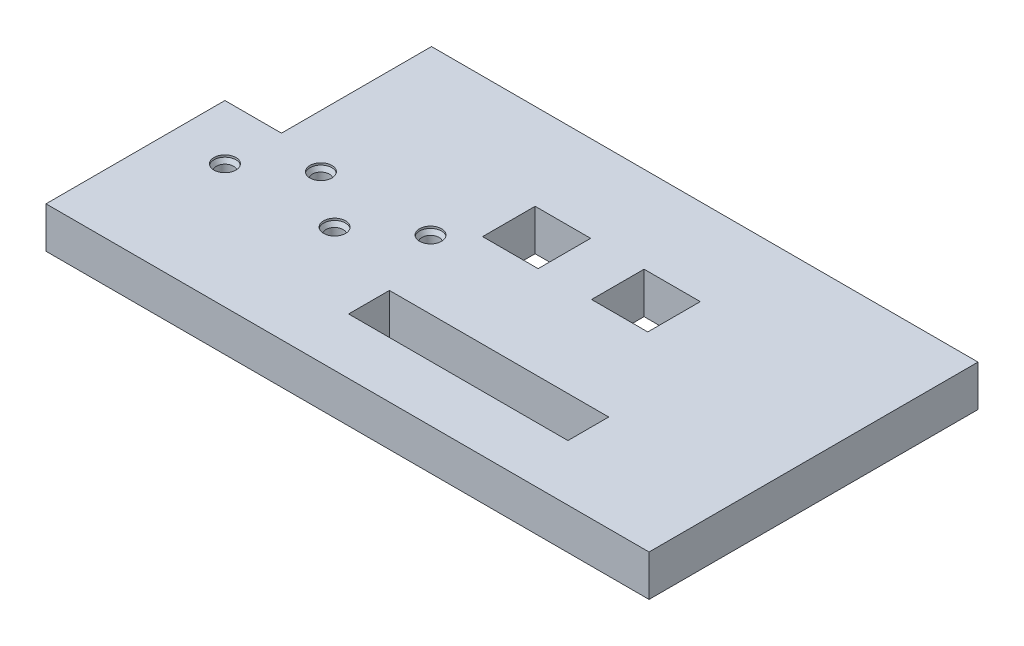
from build123d import *

# Parameters (mm, degrees)
SKETCH1_W                  = 220
SKETCH1_H                  = 120
BOSS_EXTRUDE1_DEPTH        = 15
CUT_EXTRUDE1_REACH         = 128.194
SKETCH2_W                  = 20.632503002
SKETCH2_H                  = 54.730004003
CUT_EXTRUDE2_REACH         = 128.194
SKETCH3_W                  = 20.25
SKETCH3_H                  = 19.16
SKETCH3_W_2                = 20.5
CUT_EXTRUDE3_REACH         = 128.194
SKETCH4_W                  = 80
SKETCH4_H                  = 14.88
F_6_2_6_2_DIAMETER_HOLE1_D = 6.2
SKETCH8_R                  = 4
CUT_EXTRUDE4_DEPTH         = 0.5
CHAMFER1_SIZE              = 1.8
CHAMFER1_SIZE_2            = 1.039230485


with BuildPart() as part:
    # Sketch1 → Boss-Extrude1 (new body)
    with BuildSketch(Plane(origin=(0, 0, 0), x_dir=(1, 0, 0), z_dir=(0, 1, 0))):
        Rectangle(SKETCH1_W, SKETCH1_H)
    extrude(amount=-BOSS_EXTRUDE1_DEPTH)

    # Sketch2 → Cut-Extrude1 (cut, up to next)
    with BuildSketch(Plane(origin=(0, 0, 0), x_dir=(1, 0, 0), z_dir=(0, 1, 0)), mode=Mode.PRIVATE) as cut_extrude1_sk1:
        with Locations((-99.683748499, 32.634997999)):
            Rectangle(SKETCH2_W, SKETCH2_H)
    cut_extrude1_tool1 = extrude(cut_extrude1_sk1.sketch, amount=-CUT_EXTRUDE1_REACH, mode=Mode.PRIVATE) & part.part
    add(cut_extrude1_tool1.solids().sort_by_distance((-99.683748, 0, -32.634998))[0], mode=Mode.SUBTRACT)

    # Sketch3 → Cut-Extrude2 (cut, up to next)
    with BuildSketch(Plane(origin=(0, 0, 0), x_dir=(1, 0, 0), z_dir=(0, 1, 0)), mode=Mode.PRIVATE) as cut_extrude2_sk1:
        with Locations((-9.875, 18.86)):
            Rectangle(SKETCH3_W, SKETCH3_H)
    cut_extrude2_tool1 = extrude(cut_extrude2_sk1.sketch, amount=-CUT_EXTRUDE2_REACH, mode=Mode.PRIVATE) & part.part
    # Sketch3 → Cut-Extrude2 (cut, up to next)
    with BuildSketch(Plane(origin=(0, 0, 0), x_dir=(1, 0, 0), z_dir=(0, 1, 0)), mode=Mode.PRIVATE) as cut_extrude2_sk2:
        with Locations((30, 18.86)):
            Rectangle(SKETCH3_W_2, SKETCH3_H)
    cut_extrude2_tool2 = extrude(cut_extrude2_sk2.sketch, amount=-CUT_EXTRUDE2_REACH, mode=Mode.PRIVATE) & part.part
    add(cut_extrude2_tool1.solids().sort_by_distance((-9.875, 0, -18.86))[0], mode=Mode.SUBTRACT)
    add(cut_extrude2_tool2.solids().sort_by_distance((30, 0, -18.86))[0], mode=Mode.SUBTRACT)

    # Sketch4 → Cut-Extrude3 (cut, up to next)
    with BuildSketch(Plane(origin=(0, 0, 0), x_dir=(1, 0, 0), z_dir=(0, 1, 0)), mode=Mode.PRIVATE) as cut_extrude3_sk1:
        with Locations((20, -32.16)):
            Rectangle(SKETCH4_W, SKETCH4_H)
    cut_extrude3_tool1 = extrude(cut_extrude3_sk1.sketch, amount=-CUT_EXTRUDE3_REACH, mode=Mode.PRIVATE) & part.part
    add(cut_extrude3_tool1.solids().sort_by_distance((20, 0, 32.16))[0], mode=Mode.SUBTRACT)

    # Ø6.2 (6.2) Diameter Hole1 (through all)
    with Locations(Plane(origin=(0, 0, 0), x_dir=(1, 0, 0), z_dir=(0, 1, 0))):
        with Locations((-30, 0.28), (-50, -14.72), (-70, 0.28), (-90, -14.72)):
            Hole(F_6_2_6_2_DIAMETER_HOLE1_D / 2)

    # Sketch8 → Cut-Extrude4 (cut)
    with BuildSketch(Plane(origin=(0, 0, 0), x_dir=(1, 0, 0), z_dir=(0, 1, 0))):
        with Locations(Location((-90, -14.72, 0), (0, 0, 270))):
            Circle(SKETCH8_R)
        with Locations(Location((-70, 0.28, 0), (0, 0, 270))):
            Circle(SKETCH8_R)
        with Locations(Location((-50, -14.72, 0), (0, 0, 270))):
            Circle(SKETCH8_R)
        with Locations(Location((-30, 0.28, 0), (0, 0, 270))):
            Circle(SKETCH8_R)
    extrude(amount=-CUT_EXTRUDE4_DEPTH, mode=Mode.SUBTRACT)

    # Chamfer1
    # the kernel refuses this chamfer: 1.8, 1.039230485 mm, written as the material it takes off along each edge
    with BuildSketch(Plane(origin=(-90, -0.5, 14.72), x_dir=(-1, 0, 0), z_dir=(0, 0, 1))) as chamfer1_piece_1_section:
        Polygon((3.1, CHAMFER1_SIZE), (3.1 + CHAMFER1_SIZE_2, 0), (3.1, 0), align=None)
    chamfer1_piece_1 = revolve(axis=Axis((-90, -0.5, 14.72), (0, -1, 0)), mode=Mode.PRIVATE)
    chamfer1_piece_1 = chamfer1_piece_1 & Plane(origin=(-90, -1.537716701, 14.72), x_dir=(0, 0, 1), z_dir=(0, 1, 0)) * Cylinder(4, 17, mode=Mode.PRIVATE)
    add(chamfer1_piece_1, mode=Mode.SUBTRACT)
    with BuildSketch(Plane(origin=(-30, -0.5, -0.28), x_dir=(-1, 0, 0), z_dir=(0, 0, 1))) as chamfer1_piece_2_section:
        Polygon((3.1, CHAMFER1_SIZE), (3.1 + CHAMFER1_SIZE_2, 0), (3.1, 0), align=None)
    chamfer1_piece_2 = revolve(axis=Axis((-30, -0.5, -0.28), (0, -1, 0)), mode=Mode.PRIVATE)
    chamfer1_piece_2 = chamfer1_piece_2 & Plane(origin=(-30, -1.537716701, -0.28), x_dir=(0, 0, 1), z_dir=(0, 1, 0)) * Cylinder(4, 17, mode=Mode.PRIVATE)
    add(chamfer1_piece_2, mode=Mode.SUBTRACT)
    with BuildSketch(Plane(origin=(-50, -0.5, 14.72), x_dir=(-1, 0, 0), z_dir=(0, 0, 1))) as chamfer1_piece_3_section:
        Polygon((3.1, CHAMFER1_SIZE), (3.1 + CHAMFER1_SIZE_2, 0), (3.1, 0), align=None)
    chamfer1_piece_3 = revolve(axis=Axis((-50, -0.5, 14.72), (0, -1, 0)), mode=Mode.PRIVATE)
    chamfer1_piece_3 = chamfer1_piece_3 & Plane(origin=(-50, -1.537716701, 14.72), x_dir=(0, 0, 1), z_dir=(0, 1, 0)) * Cylinder(4, 17, mode=Mode.PRIVATE)
    add(chamfer1_piece_3, mode=Mode.SUBTRACT)
    with BuildSketch(Plane(origin=(-70, -0.5, -0.28), x_dir=(-1, 0, 0), z_dir=(0, 0, 1))) as chamfer1_piece_4_section:
        Polygon((3.1, CHAMFER1_SIZE), (3.1 + CHAMFER1_SIZE_2, 0), (3.1, 0), align=None)
    chamfer1_piece_4 = revolve(axis=Axis((-70, -0.5, -0.28), (0, -1, 0)), mode=Mode.PRIVATE)
    chamfer1_piece_4 = chamfer1_piece_4 & Plane(origin=(-70, -1.537716701, -0.28), x_dir=(0, 0, 1), z_dir=(0, 1, 0)) * Cylinder(4, 17, mode=Mode.PRIVATE)
    add(chamfer1_piece_4, mode=Mode.SUBTRACT)


solid = part.part
